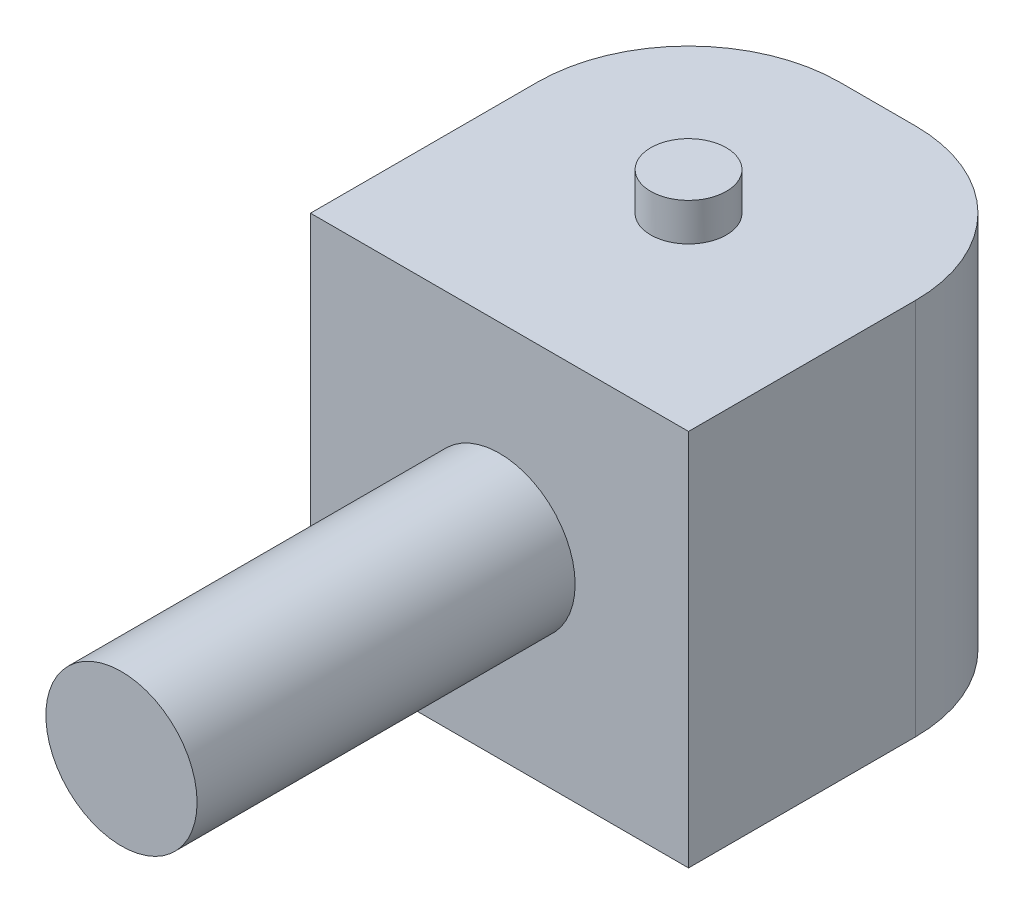
from build123d import *

# Parameters (mm, degrees)
SKETCH1_W           = 2.54
SKETCH1_H           = 2.54
BOSS_EXTRUDE1_DEPTH = 2.54
SKETCH3_R           = 0.508
BOSS_EXTRUDE2_DEPTH = 2.54
SKETCH4_R           = 0.254
BOSS_EXTRUDE3_DEPTH = 0.254
FILLET1_R           = 1.016


with BuildPart() as part:
    # Sketch1 → Boss-Extrude1 (new body)
    with BuildSketch(Plane.XY):
        Rectangle(SKETCH1_W, SKETCH1_H)
    extrude(amount=-BOSS_EXTRUDE1_DEPTH)

    # Sketch3 → Boss-Extrude2 (add)
    with BuildSketch(Plane.XY):
        Circle(SKETCH3_R)
    extrude(amount=BOSS_EXTRUDE2_DEPTH)

    # Sketch4 → Boss-Extrude3 (add)
    with BuildSketch(Plane.XZ.offset(1.27)):
        with Locations((0, -1.27)):
            Circle(SKETCH4_R)
    boss_extrude3 = extrude(amount=BOSS_EXTRUDE3_DEPTH)

    # Mirror1: Boss-Extrude3 across plane
    add(boss_extrude3.mirror(Plane.ZX))

    # Sketch6 → Revolve1 (revolve)
    with BuildSketch(Plane(origin=(0, 0, 0), x_dir=(1, 0, 0), z_dir=(0, 1, 0))):
        with BuildLine():
            Line((0, 2.54), (0, 2.7178))
            ThreePointArc((0, 2.7178), (0.125723586, 2.665723586), (0.1778, 2.54))
            Line((0.1778, 2.54), (0, 2.54))
        make_face()
    revolve(axis=Axis((0, 0, -2.54), (0, 0, -1)))

    # Fillet1
    fillet1_edges = [part.edges().sort_by_distance(p)[0] for p in [
        (1.27, 0, -2.54),
        (-1.27, 0, -2.54),
    ]]
    fillet(fillet1_edges, radius=FILLET1_R)


solid = part.part
